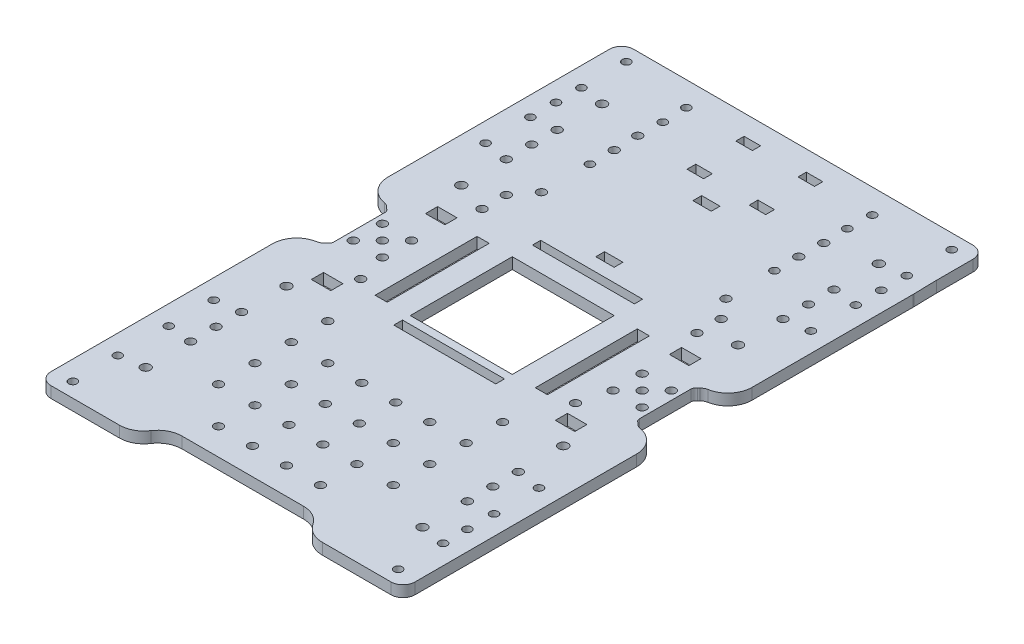
from build123d import *

# Parameters (mm, degrees)
SKETCH_2_W           = 130
SKETCH_2_H           = 200
SKETCH_2_R           = 1.8
EXTRUDE_1_DEPTH      = 4.6
FILLET_1_R           = 5
SKETCH_3_W           = 4
SKETCH_3_H           = 24
CUT_EXTRUDE_1_DEPTH  = 4.6
FILLET_2_R           = 2
FILLET_3_R           = 2
SKETCH_4_R           = 1.8
SKETCH_4_R_2         = 1.95
CUT_EXTRUDE_2_DEPTH  = 4.6
SKETCH_5_R           = 1.8
SKETCH_5_W           = 6.8
SKETCH_5_H           = 3.6
SKETCH_5_W_2         = 42
SKETCH_5_H_2         = 42
SKETCH_5_H_3         = 3.4
SKETCH_5_W_3         = 70
SKETCH_5_H_4         = 18
CUT_EXTRUDE_3_DEPTH  = 4.6
FILLET_4_R           = 10
FILLET_5_R           = 10
SKETCH_6_R           = 1.8
CUT_EXTRUDE_4_DEPTH  = 4.6
SKETCH_7_R           = 1.8
CUT_EXTRUDE_5_DEPTH  = 4.6
SKETCH_8_W           = 7.56096601
SKETCH_8_H           = 3.597038402
SKETCH_8_H_2         = 3.621629188
SKETCH_8_W_2         = 3.6
SKETCH_8_H_3         = 6.8
CUT_EXTRUDE_6_DEPTH  = 4.6
SKETCH_10_R          = 1.8
CUT_EXTRUDE_8_DEPTH  = 4.6
SKETCH_9_W           = 8
SKETCH_9_H           = 5
SKETCH_9_W_2         = 5
SKETCH_9_H_2         = 42
CUT_EXTRUDE_9_DEPTH  = 4.6
EXTRUDE_START        = 2
SKETCH_12_W          = 18.75
SKETCH_12_H          = 71.5
SKETCH_12_R          = 1.95
SKETCH_12_R_2        = 1.8
SKETCH_12_R_3        = 1.814304703
SKETCH_12_W_2        = 4
SKETCH_12_H_2        = 2
SKETCH_12_W_3        = 44.25
SKETCH_12_H_3        = 9.499668345
SKETCH_12_H_4        = 71.502072164
SKETCH_12_H_5        = 4.00066331
SKETCH_12_H_6        = 10.999668345
SKETCH_12_H_7        = 10.799999999
SKETCH_12_W_4        = 15.750000002
SKETCH_12_H_8        = 4
SKETCH_12_W_5        = 24.499999998
SKETCH_12_W_6        = 24.5
SKETCH_12_W_7        = 15.75
SKETCH_12_H_9        = 11
SKETCH_12_H_10       = 10.8
SKETCH_12_H_11       = 0.5
SKETCH_12_W_8        = 15.750000003
SKETCH_12_W_9        = 3.999999999
SKETCH_12_W_10       = 14.75
SKETCH_12_H_12       = 76.497927836
SKETCH_12_H_13       = 76.5
SKETCH_12_H_14       = 11.97
SKETCH_12_H_15       = 9.167588033
SKETCH_12_H_16       = 0.69
SKETCH_12_H_17       = 1.832411967
SKETCH_12_H_18       = 1.142411967
SKETCH_12_H_19       = 1.059701493
SKETCH_12_H_20       = 8.290597014
SKETCH_12_H_21       = 1.559701493
EXTRUDE_2_DEPTH      = 2
SKETCH_13_W          = 30
SKETCH_13_H          = 4
EXTRUDE_3_DEPTH      = 2
FILLET_6_R           = 5
SKETCH_14_W          = 42
SKETCH_14_H          = 3.4
EXTRUDE_4_DEPTH      = 4.6
SKETCH_15_W          = 42
SKETCH_15_H          = 3.6
CUT_EXTRUDE_10_DEPTH = 10
SKETCH_16_W          = 204.995685258
SKETCH_16_H          = 218.219063178
CUT_EXTRUDE_11_DEPTH = 2
SKETCH_17_W          = 15
SKETCH_17_H          = 86
EXTRUDE_5_DEPTH      = 4.6
FILLET_7_R           = 3.5
FILLET_8_R           = 10
SKETCH_18_R          = 1.7
SKETCH_18_R_2        = 1.8
CUT_EXTRUDE_12_DEPTH = 10
EXTRUDE_6_DEPTH      = 4.6
SKETCH_21_R          = 1.7
SKETCH_21_W          = 6.8
SKETCH_21_H          = 3.4
CUT_EXTRUDE_13_DEPTH = 10
SKETCH_23_W          = 5.699842395
SKETCH_23_H          = 8.457830651
SKETCH_23_W_2        = 8.457830652
SKETCH_23_H_2        = 10.84808714
SKETCH_23_W_3        = 8.83667556
SKETCH_23_H_3        = 72.0482929
SKETCH_23_W_4        = 8.515983726
SKETCH_23_H_4        = 70.769164604
SKETCH_23_H_5        = 67.65499986
EXTRUDE_7_DEPTH      = 4.6
SKETCH_22_R          = 1.7
SKETCH_22_R_2        = 1.8
CUT_EXTRUDE_14_DEPTH = 10
SKETCH_24_R          = 1.7
CUT_EXTRUDE_15_DEPTH = 10
FILLET_11_R          = 5
FILLET_12_R          = 10
FILLET_13_R          = 10


# Some blends are built 0.0001 mm under size
with BuildPart() as part:
    # 草图2 → 凸台-拉伸1 (new body)
    with BuildSketch(Plane(origin=(0, 0, 0), x_dir=(1, 0, 0), z_dir=(0, 1, 0))):
        Rectangle(SKETCH_2_W, SKETCH_2_H)
        with Locations(Location((-59.5, 6, 0), (0, 0, 270))):
            Circle(SKETCH_2_R, mode=Mode.SUBTRACT)
        with Locations(Location((-47.5, 6, 0), (0, 0, 270))):
            Circle(SKETCH_2_R, mode=Mode.SUBTRACT)
        with Locations(Location((-59.5, -6, 0), (0, 0, 270))):
            Circle(SKETCH_2_R, mode=Mode.SUBTRACT)
        with Locations(Location((-47.5, -6, 0), (0, 0, 270))):
            Circle(SKETCH_2_R, mode=Mode.SUBTRACT)
        with Locations(Location((-53.5, 0, 0), (0, 0, 270))):
            Circle(SKETCH_2_R, mode=Mode.SUBTRACT)
        with Locations(Location((53.5, 0, 0), (0, 0, 270))):
            Circle(SKETCH_2_R, mode=Mode.SUBTRACT)
        with Locations(Location((59.5, 6, 0), (0, 0, 270))):
            Circle(SKETCH_2_R, mode=Mode.SUBTRACT)
        with Locations(Location((59.5, -6, 0), (0, 0, 270))):
            Circle(SKETCH_2_R, mode=Mode.SUBTRACT)
        with Locations(Location((47.5, -6, 0), (0, 0, 270))):
            Circle(SKETCH_2_R, mode=Mode.SUBTRACT)
        with Locations(Location((47.5, 6, 0), (0, 0, 270))):
            Circle(SKETCH_2_R, mode=Mode.SUBTRACT)
    extrude(amount=EXTRUDE_1_DEPTH)

    # 圆角1
    fillet_1_edges = [part.edges().sort_by_distance(p)[0] for p in [
        (65, 2.3, 100),
        (-65, 2.3, 100),
        (-65, 2.3, -100),
        (65, 2.3, -100),
    ]]
    fillet(fillet_1_edges, radius=FILLET_1_R)

    # 草图3 → 切除-拉伸1 (cut)
    with BuildSketch(Plane(origin=(0, 4.6, 0), x_dir=(1, 0, 0), z_dir=(0, 1, 0))):
        with Locations((-65, 0)):
            Rectangle(SKETCH_3_W, SKETCH_3_H)
        with Locations((65, 0)):
            Rectangle(SKETCH_3_W, SKETCH_3_H)
    extrude(amount=-CUT_EXTRUDE_1_DEPTH, mode=Mode.SUBTRACT)

    # 圆角2
    fillet_2_edges = [part.edges().sort_by_distance(p)[0] for p in [
        (65, 2.3, 12),
        (65, 2.3, -12),
        (-65, 2.3, 12),
        (-65, 2.3, -12),
    ]]
    fillet(fillet_2_edges, radius=FILLET_2_R - 0.0001)  # a hair under: the kernel refuses the full size

    # 圆角3
    fillet_3_edges = [part.edges().sort_by_distance(p)[0] for p in [
        (-63, 2.3, 12),
        (-63, 2.3, -12),
        (63, 2.3, -12),
        (63, 2.3, 12),
    ]]
    fillet(fillet_3_edges, radius=FILLET_3_R)

    # 草图4 → 切除-拉伸2 (cut)
    with BuildSketch(Plane(origin=(0, 0, 0), x_dir=(1, 0, 0), z_dir=(0, 1, 0))):
        with Locations(Location((57, 65, 0), (0, 0, 270))):
            Circle(SKETCH_4_R)
        with Locations(Location((57, 75.5, 0), (0, 0, 270))):
            Circle(SKETCH_4_R)
        with Locations(Location((57, 54.5, 0), (0, 0, 270))):
            Circle(SKETCH_4_R)
        with Locations(Location((57, 94, 0), (0, 0, 270))):
            Circle(SKETCH_4_R_2)
        with Locations(Location((57, 36, 0), (0, 0, 270))):
            Circle(SKETCH_4_R_2)
        with Locations(Location((-57, 94, 0), (0, 0, 270))):
            Circle(SKETCH_4_R_2)
        with Locations(Location((-57, 75.5, 0), (0, 0, 270))):
            Circle(SKETCH_4_R)
        with Locations(Location((-57, 65, 0), (0, 0, 270))):
            Circle(SKETCH_4_R)
        with Locations(Location((-57, 54.5, 0), (0, 0, 270))):
            Circle(SKETCH_4_R)
        with Locations(Location((-57, 36, 0), (0, 0, 270))):
            Circle(SKETCH_4_R_2)
        with Locations(Location((-57, -36, 0), (0, 0, 270))):
            Circle(SKETCH_4_R_2)
        with Locations(Location((-57, -65, 0), (0, 0, 270))):
            Circle(SKETCH_4_R)
        with Locations(Location((-57, -54.5, 0), (0, 0, 270))):
            Circle(SKETCH_4_R)
        with Locations(Location((-57, -75.5, 0), (0, 0, 270))):
            Circle(SKETCH_4_R)
        with Locations(Location((-57, -94, 0), (0, 0, 270))):
            Circle(SKETCH_4_R_2)
        with Locations(Location((57, -65, 0), (0, 0, 270))):
            Circle(SKETCH_4_R)
        with Locations(Location((57, -75.5, 0), (0, 0, 270))):
            Circle(SKETCH_4_R)
        with Locations(Location((57, -54.5, 0), (0, 0, 270))):
            Circle(SKETCH_4_R)
        with Locations(Location((57, -36, 0), (0, 0, 270))):
            Circle(SKETCH_4_R_2)
        with Locations(Location((57, -94, 0), (0, 0, 270))):
            Circle(SKETCH_4_R_2)
    extrude(amount=CUT_EXTRUDE_2_DEPTH, mode=Mode.SUBTRACT)

    # 草图5 → 切除-拉伸3 (cut)
    with BuildSketch(Plane(origin=(0, 4.6, 0), x_dir=(1, 0, 0), z_dir=(0, 1, 0))):
        with Locations(Location((38.3, 90, 0), (0, 0, 270))):
            Circle(SKETCH_5_R)
        with Locations(Location((-38.3, 90, 0), (0, 0, 270))):
            Circle(SKETCH_5_R)
        with Locations((-12.8, 90)):
            Rectangle(SKETCH_5_W, SKETCH_5_H)
        with Locations((12.8, 90)):
            Rectangle(SKETCH_5_W, SKETCH_5_H)
        Rectangle(SKETCH_5_W_2, SKETCH_5_H_2)
        with Locations((0, 31)):
            Rectangle(SKETCH_5_W_2, SKETCH_5_H_3)
        with Locations((0, -31)):
            Rectangle(SKETCH_5_W_2, SKETCH_5_H_3)
        with Locations((0, -100)):
            Rectangle(SKETCH_5_W_3, SKETCH_5_H_4)
    extrude(amount=-CUT_EXTRUDE_3_DEPTH, mode=Mode.SUBTRACT)

    # 圆角4
    # the kernel refuses this fillet: 10 mm, written as the material it takes off along each edge
    with BuildSketch(Plane(origin=(-35, -24.874685928, 100), x_dir=(-1, 0, 0), z_dir=(0, 1, 0))) as fillet_4_piece_1:
        with BuildLine():
            CenterArc((9.949874371, -10), FILLET_4_R, 90, 84.260829523)
            Line((0, -9), (-0.198997487, -8.98))
            ThreePointArc((-0.198997487, -8.98), (-0.2, -4.5), (-0.2, 0))
            Line((-0.2, 0), (0, 0.2))
            Line((0, 0.2), (9.949874371, 0.2))
            Line((9.949874371, 0.2), (9.949874371, 0))
        make_face()
    extrude(amount=54.349371855, mode=Mode.SUBTRACT)
    with BuildSketch(Plane(origin=(35, 29.474685928, 100), x_dir=(0, 0, -1), z_dir=(0, -1, 0))) as fillet_4_piece_2:
        with BuildLine():
            CenterArc((10, 9.949874371), FILLET_4_R, 180, 84.260829523)
            Line((0, 9.949874371), (-0.2, 9.949874371))
            Line((-0.2, 9.949874371), (-0.2, 0))
            Line((-0.2, 0), (0, -0.2))
            ThreePointArc((0, -0.2), (4.5, -0.2), (8.98, -0.198997487))
            Line((8.98, -0.198997487), (9, 0))
        make_face()
    extrude(amount=54.349371855, mode=Mode.SUBTRACT)

    # 圆角5
    fillet_5_edges = [part.edges().sort_by_distance(p)[0] for p in [
        (35, 2.3, 91),
        (-35, 2.3, 91),
    ]]
    fillet(fillet_5_edges, radius=FILLET_5_R)

    # 草图6 → 切除-拉伸4 (cut)
    with BuildSketch(Plane(origin=(0, 4.6, 0), x_dir=(1, 0, 0), z_dir=(0, 1, 0))):
        with Locations(Location((-7, -85, 0), (0, 0, 270))):
            Circle(SKETCH_6_R)
        with Locations(Location((-21, -85, 0), (0, 0, 270))):
            Circle(SKETCH_6_R)
        with Locations(Location((7, -85, 0), (0, 0, 270))):
            Circle(SKETCH_6_R)
        with Locations(Location((21, -85, 0), (0, 0, 270))):
            Circle(SKETCH_6_R)
        with Locations(Location((21, -70, 0), (0, 0, 270))):
            Circle(SKETCH_6_R)
        with Locations(Location((7, -70, 0), (0, 0, 270))):
            Circle(SKETCH_6_R)
        with Locations(Location((-7, -70, 0), (0, 0, 270))):
            Circle(SKETCH_6_R)
        with Locations(Location((-21, -70, 0), (0, 0, 270))):
            Circle(SKETCH_6_R)
        with Locations(Location((-21, -55, 0), (0, 0, 270))):
            Circle(SKETCH_6_R)
        with Locations(Location((-7, -55, 0), (0, 0, 270))):
            Circle(SKETCH_6_R)
        with Locations(Location((7, -55, 0), (0, 0, 270))):
            Circle(SKETCH_6_R)
        with Locations(Location((21, -55, 0), (0, 0, 270))):
            Circle(SKETCH_6_R)
        with Locations(Location((36, -70, 0), (0, 0, 270))):
            Circle(SKETCH_6_R)
        with Locations(Location((36, -55, 0), (0, 0, 270))):
            Circle(SKETCH_6_R)
        with Locations(Location((36, -40, 0), (0, 0, 270))):
            Circle(SKETCH_6_R)
        with Locations(Location((-36, -40, 0), (0, 0, 270))):
            Circle(SKETCH_6_R)
        with Locations(Location((-36, -55, 0), (0, 0, 270))):
            Circle(SKETCH_6_R)
        with Locations(Location((-36, -70, 0), (0, 0, 270))):
            Circle(SKETCH_6_R)
    extrude(amount=-CUT_EXTRUDE_4_DEPTH, mode=Mode.SUBTRACT)

    # 草图7 → 切除-拉伸5 (cut)
    with BuildSketch(Plane(origin=(0, 4.6, 0), x_dir=(1, 0, 0), z_dir=(0, 1, 0))):
        with Locations(Location((-38, 80, 0), (0, 0, 270))):
            Circle(SKETCH_7_R)
        with Locations(Location((38, 80, 0), (0, 0, 270))):
            Circle(SKETCH_7_R)
        with Locations(Location((38, 50, 0), (0, 0, 270))):
            Circle(SKETCH_7_R)
        with Locations(Location((-38, 50, 0), (0, 0, 270))):
            Circle(SKETCH_7_R)
    extrude(amount=-CUT_EXTRUDE_5_DEPTH, mode=Mode.SUBTRACT)

    # 草图8 → 切除-拉伸6 (cut)
    with BuildSketch(Plane(origin=(0, 4.6, 0), x_dir=(1, 0, 0), z_dir=(0, 1, 0))):
        with Locations((0, 80)):
            Rectangle(SKETCH_8_W, SKETCH_8_H)
        with Locations((0, 40)):
            Rectangle(SKETCH_8_W, SKETCH_8_H_2)
        with Locations((35, 65)):
            Rectangle(SKETCH_8_W_2, SKETCH_8_H_3)
        with Locations((-35, 65)):
            Rectangle(SKETCH_8_W_2, SKETCH_8_H_3)
    extrude(amount=-CUT_EXTRUDE_6_DEPTH, mode=Mode.SUBTRACT)

    # 草图10 → 切除-拉伸8 (cut)
    with BuildSketch(Plane(origin=(0, 4.6, 0), x_dir=(1, 0, 0), z_dir=(0, 1, 0))):
        with Locations(Location((44.25, 41.8, 0), (0, 0, 270))):
            Circle(SKETCH_10_R)
        with Locations(Location((-44.25, 41.810125838, 0), (0, 0, 270))):
            Circle(SKETCH_10_R)
        with Locations(Location((-44.25, -18.189874162, 0), (0, 0, 270))):
            Circle(SKETCH_10_R)
        with Locations(Location((44.25, -18.2, 0), (0, 0, 270))):
            Circle(SKETCH_10_R)
        with Locations(Location((-44.25, 31.810125838, 0), (0, 0, 270))):
            Circle(SKETCH_10_R)
        with Locations(Location((44.25, 31.810125838, 0), (0, 0, 270))):
            Circle(SKETCH_10_R)
    extrude(amount=-CUT_EXTRUDE_8_DEPTH, mode=Mode.SUBTRACT)

    # 草图9 → 切除-拉伸9 (cut)
    with BuildSketch(Plane(origin=(0, 4.6, 0), x_dir=(1, 0, 0), z_dir=(0, 1, 0))):
        with Locations((-50.25, 21)):
            Rectangle(SKETCH_9_W, SKETCH_9_H)
        with Locations((50.25, 21)):
            Rectangle(SKETCH_9_W, SKETCH_9_H)
        with Locations((-50.25, -26)):
            Rectangle(SKETCH_9_W, SKETCH_9_H)
        with Locations((50.25, -26)):
            Rectangle(SKETCH_9_W, SKETCH_9_H)
        with Locations((33, 0)):
            Rectangle(SKETCH_9_W_2, SKETCH_9_H_2)
        with Locations((-33, 0)):
            Rectangle(SKETCH_9_W_2, SKETCH_9_H_2)
    extrude(amount=-CUT_EXTRUDE_9_DEPTH, mode=Mode.SUBTRACT)

    # 草图12 → 凸台-拉伸2 (add)
    # profile 1 of 46: a face of its own
    with BuildSketch(Plane.XZ.offset(EXTRUDE_START)):
        with Locations((-55.625, 64.25)):
            Rectangle(SKETCH_12_W, SKETCH_12_H)
        with Locations(Location((-57, 36, 0), (0, 0, 270))):
            Circle(SKETCH_12_R, mode=Mode.SUBTRACT)
        with Locations(Location((-57, 54.5, 0), (0, 0, 270))):
            Circle(SKETCH_12_R_2, mode=Mode.SUBTRACT)
        with Locations(Location((-57, 65, 0), (0, 0, 270))):
            Circle(SKETCH_12_R_3, mode=Mode.SUBTRACT)
        with Locations(Location((-57, 75.5, 0), (0, 0, 270))):
            Circle(SKETCH_12_R_2, mode=Mode.SUBTRACT)
        with Locations(Location((-57, 94, 0), (0, 0, 270))):
            Circle(SKETCH_12_R, mode=Mode.SUBTRACT)
    # profile 2 of 46: a face of its own
    with BuildSketch(Plane.XZ.offset(EXTRUDE_START)):
        with Locations((0, 90)):
            Rectangle(SKETCH_12_W_2, SKETCH_12_H_2)
    # profile 3 of 46: a face of its own
    with BuildSketch(Plane.XZ.offset(EXTRUDE_START)):
        with Locations((24.125, 90)):
            Rectangle(SKETCH_12_W_3, SKETCH_12_H_2)
    # profile 4 of 46: a face of its own
    with BuildSketch(Plane.XZ.offset(EXTRUDE_START)):
        with Locations((-24.125, 90)):
            Rectangle(SKETCH_12_W_3, SKETCH_12_H_2)
    # profile 5 of 46: a face of its own
    with BuildSketch(Plane.XZ.offset(EXTRUDE_START)):
        with Locations((0, 84.250165828)):
            Rectangle(SKETCH_12_W_2, SKETCH_12_H_3)
    # profile 6 of 46: a face of its own
    with BuildSketch(Plane.XZ.offset(EXTRUDE_START)):
        with Locations((55.625, 64.251036082)):
            Rectangle(SKETCH_12_W, SKETCH_12_H_4)
        with Locations(Location((57, 36, 0), (0, 0, 270))):
            Circle(SKETCH_12_R, mode=Mode.SUBTRACT)
        with Locations(Location((57, 54.5, 0), (0, 0, 270))):
            Circle(SKETCH_12_R_2, mode=Mode.SUBTRACT)
        with Locations(Location((57, 65, 0), (0, 0, 270))):
            Circle(SKETCH_12_R_2, mode=Mode.SUBTRACT)
        with Locations(Location((57, 75.5, 0), (0, 0, 270))):
            Circle(SKETCH_12_R_2, mode=Mode.SUBTRACT)
        with Locations(Location((57, 94, 0), (0, 0, 270))):
            Circle(SKETCH_12_R, mode=Mode.SUBTRACT)
    # profile 7 of 46: a face of its own
    with BuildSketch(Plane.XZ.offset(EXTRUDE_START)):
        with Locations((24.125, 77.5)):
            Rectangle(SKETCH_12_W_3, SKETCH_12_H_5)
    # profile 8 of 46: a face of its own
    with BuildSketch(Plane.XZ.offset(EXTRUDE_START)):
        with Locations((0, 77.5)):
            Rectangle(SKETCH_12_W_2, SKETCH_12_H_5)
    # profile 9 of 46: a face of its own
    with BuildSketch(Plane.XZ.offset(EXTRUDE_START)):
        with Locations((-24.125, 77.5)):
            Rectangle(SKETCH_12_W_3, SKETCH_12_H_5)
    # profile 10 of 46: a face of its own
    with BuildSketch(Plane.XZ.offset(EXTRUDE_START)):
        with Locations((0, 69.999834173)):
            Rectangle(SKETCH_12_W_2, SKETCH_12_H_6)
    # profile 11 of 46: a face of its own
    with BuildSketch(Plane.XZ.offset(EXTRUDE_START)):
        with Locations((28.5, 69.9)):
            Rectangle(SKETCH_12_W_2, SKETCH_12_H_7)
    # profile 12 of 46: a face of its own
    with BuildSketch(Plane.XZ.offset(EXTRUDE_START)):
        with Locations((-28.499999998, 69.9)):
            Rectangle(SKETCH_12_W_2, SKETCH_12_H_7)
    # profile 13 of 46: a face of its own
    with BuildSketch(Plane.XZ.offset(EXTRUDE_START)):
        with Locations((-38.374999999, 62.5)):
            Rectangle(SKETCH_12_W_4, SKETCH_12_H_8)
    # profile 14 of 46: a face of its own
    with BuildSketch(Plane.XZ.offset(EXTRUDE_START)):
        with Locations((-28.499999998, 62.5)):
            Rectangle(SKETCH_12_W_2, SKETCH_12_H_8)
    # profile 15 of 46: a face of its own
    with BuildSketch(Plane.XZ.offset(EXTRUDE_START)):
        with Locations((-14.249999999, 62.5)):
            Rectangle(SKETCH_12_W_5, SKETCH_12_H_8)
    # profile 16 of 46: a face of its own
    with BuildSketch(Plane.XZ.offset(EXTRUDE_START)):
        with Locations((0, 62.5)):
            Rectangle(SKETCH_12_W_2, SKETCH_12_H_8)
    # profile 17 of 46: a face of its own
    with BuildSketch(Plane.XZ.offset(EXTRUDE_START)):
        with Locations((14.25, 62.5)):
            Rectangle(SKETCH_12_W_6, SKETCH_12_H_8)
    # profile 18 of 46: a face of its own
    with BuildSketch(Plane.XZ.offset(EXTRUDE_START)):
        with Locations((28.5, 62.5)):
            Rectangle(SKETCH_12_W_2, SKETCH_12_H_8)
    # profile 19 of 46: a face of its own
    with BuildSketch(Plane.XZ.offset(EXTRUDE_START)):
        with Locations((38.375, 62.5)):
            Rectangle(SKETCH_12_W_7, SKETCH_12_H_8)
    # profile 20 of 46: a face of its own
    with BuildSketch(Plane.XZ.offset(EXTRUDE_START)):
        with Locations((28.5, 55)):
            Rectangle(SKETCH_12_W_2, SKETCH_12_H_9)
    # profile 21 of 46: a face of its own
    with BuildSketch(Plane.XZ.offset(EXTRUDE_START)):
        with Locations((38.375, 47.5)):
            Rectangle(SKETCH_12_W_7, SKETCH_12_H_8)
    # profile 22 of 46: a face of its own
    with BuildSketch(Plane.XZ.offset(EXTRUDE_START)):
        with Locations((28.5, 40.1)):
            Rectangle(SKETCH_12_W_2, SKETCH_12_H_10)
    # profile 23 of 46: a face of its own
    with BuildSketch(Plane.XZ.offset(EXTRUDE_START)):
        Polygon((-46.25, 34.7), (-46.25, 32.7), (46.25, 32.7), (46.25, 34.7), (30.5, 34.7), (26.5, 34.7), (-26.499999999, 34.7), (-30.499999997, 34.7), align=None)
    # profile 24 of 46: a face of its own
    with BuildSketch(Plane.XZ.offset(EXTRUDE_START)):
        with Locations((28.5, 47.5)):
            Rectangle(SKETCH_12_W_2, SKETCH_12_H_8)
    # profile 25 of 46: a face of its own
    with BuildSketch(Plane.XZ.offset(EXTRUDE_START)):
        Polygon((-26.499999998, 49.5), (-26.499999998, 45.5), (26.5, 45.5), (26.5, 49.5), (2, 49.5), (2, 49), (-2, 49), (-2, 49.5), align=None)
    # profile 26 of 46: a face of its own
    with BuildSketch(Plane.XZ.offset(EXTRUDE_START)):
        with Locations((0, 55)):
            Rectangle(SKETCH_12_W_2, SKETCH_12_H_9)
    # profile 27 of 46: a face of its own
    with BuildSketch(Plane.XZ.offset(EXTRUDE_START)):
        with Locations((0, 49.25)):
            Rectangle(SKETCH_12_W_2, SKETCH_12_H_11)
    # profile 28 of 46: a face of its own
    with BuildSketch(Plane.XZ.offset(EXTRUDE_START)):
        Polygon((-30.499999998, 60.5), (-30.499999997, 49.5), (-26.499999998, 49.5), (-26.499999998, 60.5), align=None)
    # profile 29 of 46: a face of its own
    with BuildSketch(Plane.XZ.offset(EXTRUDE_START)):
        with Locations((-38.374999999, 47.5)):
            Rectangle(SKETCH_12_W_8, SKETCH_12_H_8)
    # profile 30 of 46: a face of its own
    with BuildSketch(Plane.XZ.offset(EXTRUDE_START)):
        with Locations((-28.499999998, 47.5)):
            Rectangle(SKETCH_12_W_9, SKETCH_12_H_8)
    # profile 31 of 46: a face of its own
    with BuildSketch(Plane.XZ.offset(EXTRUDE_START)):
        Polygon((-30.499999997, 45.5), (-30.499999997, 34.699999999), (-26.499999999, 34.7), (-26.499999998, 45.5), align=None)
    # profile 32 of 46: a face of its own
    with BuildSketch(Plane.XZ.offset(EXTRUDE_START)):
        with Locations((57.625, -61.748963918)):
            Rectangle(SKETCH_12_W_10, SKETCH_12_H_12)
        with Locations(Location((57, -94, 0), (0, 0, 270))):
            Circle(SKETCH_12_R, mode=Mode.SUBTRACT)
        with Locations(Location((57, -75.5, 0), (0, 0, 270))):
            Circle(SKETCH_12_R_2, mode=Mode.SUBTRACT)
        with Locations(Location((57, -65, 0), (0, 0, 270))):
            Circle(SKETCH_12_R_2, mode=Mode.SUBTRACT)
        with Locations(Location((57, -54.5, 0), (0, 0, 270))):
            Circle(SKETCH_12_R_2, mode=Mode.SUBTRACT)
        with Locations(Location((57, -36, 0), (0, 0, 270))):
            Circle(SKETCH_12_R, mode=Mode.SUBTRACT)
    # profile 33 of 46: a face of its own
    with BuildSketch(Plane.XZ.offset(EXTRUDE_START)):
        with Locations((-57.625, -61.75)):
            Rectangle(SKETCH_12_W_10, SKETCH_12_H_13)
        with Locations(Location((-57, -36, 0), (0, 0, 270))):
            Circle(SKETCH_12_R, mode=Mode.SUBTRACT)
        with Locations(Location((-57, -54.5, 0), (0, 0, 270))):
            Circle(SKETCH_12_R_2, mode=Mode.SUBTRACT)
        with Locations(Location((-57, -65, 0), (0, 0, 270))):
            Circle(SKETCH_12_R_2, mode=Mode.SUBTRACT)
        with Locations(Location((-57, -75.5, 0), (0, 0, 270))):
            Circle(SKETCH_12_R_2, mode=Mode.SUBTRACT)
        with Locations(Location((-57, -94, 0), (0, 0, 270))):
            Circle(SKETCH_12_R, mode=Mode.SUBTRACT)
    # profile 34 of 46: a face of its own
    with BuildSketch(Plane.XZ.offset(EXTRUDE_START)):
        Polygon((50.25, -54.875), (-50.25, -54.875), (-50.25, -58.875), (-2, -58.875), (2, -58.875), (50.25, -58.875), align=None)
    # profile 35 of 46: a face of its own
    with BuildSketch(Plane.XZ.offset(EXTRUDE_START)):
        with Locations((0, -64.86)):
            Rectangle(SKETCH_12_W_2, SKETCH_12_H_14)
    # profile 36 of 46: a face of its own
    with BuildSketch(Plane.XZ.offset(EXTRUDE_START)):
        Polygon((-2, -70.845), (-50.25, -70.845), (-50.25, -74.845), (-21.990241502, -74.845), (-21.990241502, -74.155), (-17.990241502, -74.155), (-17.990241502, -74.845), (17.990241502, -74.845), (21.990241502, -74.845), (50.25, -74.845), (50.25, -70.845), (2, -70.845), align=None)
    # profile 37 of 46: a face of its own
    with BuildSketch(Plane.XZ.offset(EXTRUDE_START)):
        with Locations((19.990241502, -79.428794017)):
            Rectangle(SKETCH_12_W_2, SKETCH_12_H_15)
    # profile 38 of 46: a face of its own
    with BuildSketch(Plane.XZ.offset(EXTRUDE_START)):
        with Locations((-19.990241502, -79.428794017)):
            Rectangle(SKETCH_12_W_2, SKETCH_12_H_15)
    # profile 39 of 46: a face of its own
    with BuildSketch(Plane.XZ.offset(EXTRUDE_START)):
        with Locations((-19.990241502, -74.5)):
            Rectangle(SKETCH_12_W_2, SKETCH_12_H_16)
    # profile 40 of 46: a face of its own
    with BuildSketch(Plane.XZ.offset(EXTRUDE_START)):
        Polygon((-50.25, -84.012588033), (-50.25, -86.012588033), (-2, -86.012588033), (-2, -84.95288654), (2, -84.95288654), (2, -86.012588033), (50.25, -86.012588033), (50.25, -84.012588033), (21.990241502, -84.012588033), (21.990241502, -85.155), (17.990241502, -85.155), (17.990241502, -84.012588033), (-17.990241502, -84.012588033), (-17.990241502, -85.845), (-21.990241502, -85.845), (-21.990241502, -84.012588033), align=None)
    # profile 41 of 46: a face of its own
    with BuildSketch(Plane.XZ.offset(EXTRUDE_START)):
        with Locations((-19.990241502, -84.928794017)):
            Rectangle(SKETCH_12_W_2, SKETCH_12_H_17)
    # profile 42 of 46: a face of its own
    with BuildSketch(Plane.XZ.offset(EXTRUDE_START)):
        with Locations((19.990241502, -84.583794017)):
            Rectangle(SKETCH_12_W_2, SKETCH_12_H_18)
    # profile 43 of 46: a face of its own
    with BuildSketch(Plane.XZ.offset(EXTRUDE_START)):
        with Locations((0, -85.482737286)):
            Rectangle(SKETCH_12_W_2, SKETCH_12_H_19)
    # profile 44 of 46: a face of its own
    with BuildSketch(Plane.XZ.offset(EXTRUDE_START)):
        with Locations((0, -90.15788654)):
            Rectangle(SKETCH_12_W_2, SKETCH_12_H_20)
    # profile 45 of 46: a face of its own
    with BuildSketch(Plane.XZ.offset(EXTRUDE_START)):
        Polygon((-50.25, -94.303185047), (-50.25, -97.303185047), (50.25, -97.303185047), (50.25, -94.303185047), (2, -94.303185047), (2, -95.86288654), (-2, -95.86288654), (-2, -94.303185047), align=None)
    # profile 46 of 46: a face of its own
    with BuildSketch(Plane.XZ.offset(EXTRUDE_START)):
        with Locations((0, -95.083035794)):
            Rectangle(SKETCH_12_W_2, SKETCH_12_H_21)
    extrude(amount=-EXTRUDE_2_DEPTH)

    # 草图13 → 凸台-拉伸3 (add)
    with BuildSketch(Plane.XZ):
        with Locations((0, -43.810814594)):
            Rectangle(SKETCH_13_W, SKETCH_13_H)
    extrude(amount=EXTRUDE_3_DEPTH)

    # 圆角6
    # the kernel refuses this fillet: 5 mm, written as the material it takes off along each edge
    with BuildSketch(Plane(origin=(-65, -2, -100), x_dir=(0, 0, 1), z_dir=(0, 1, 0)), Plane(origin=(-65, -2, 100), x_dir=(1, 0, 0), z_dir=(0, 1, 0)), Plane(origin=(65, -2, 100.002072164), x_dir=(0, 0, -1), z_dir=(0, 1, 0))) as fillet_6_piece_1:
        with BuildLine():
            CenterArc((FILLET_6_R, FILLET_6_R), FILLET_6_R, 180, 90)
            Line((0, FILLET_6_R), (-FILLET_6_R * 0.02, FILLET_6_R))
            Line((-FILLET_6_R * 0.02, FILLET_6_R), (-FILLET_6_R * 0.02, -FILLET_6_R * 0.02))
            Line((-FILLET_6_R * 0.02, -FILLET_6_R * 0.02), (FILLET_6_R, -FILLET_6_R * 0.02))
            Line((FILLET_6_R, -FILLET_6_R * 0.02), (FILLET_6_R, 0))
        make_face()
    extrude(amount=2, mode=Mode.SUBTRACT)
    with BuildSketch(Plane(origin=(65, -2, -99.997927836), x_dir=(0, 0, 1), z_dir=(0, 1, 0))) as fillet_6_piece_2:
        with BuildLine():
            CenterArc((FILLET_6_R, -FILLET_6_R), FILLET_6_R, 90, 90)
            Line((0, -FILLET_6_R), (-FILLET_6_R * 0.02, -FILLET_6_R))
            Line((-FILLET_6_R * 0.02, -FILLET_6_R), (-FILLET_6_R * 0.02, FILLET_6_R * 0.02))
            Line((-FILLET_6_R * 0.02, FILLET_6_R * 0.02), (FILLET_6_R, FILLET_6_R * 0.02))
            Line((FILLET_6_R, FILLET_6_R * 0.02), (FILLET_6_R, 0))
        make_face()
    extrude(amount=2, mode=Mode.SUBTRACT)

    # 草图14 → 凸台-拉伸4 (add)
    with BuildSketch(Plane(origin=(0, 4.6, 0), x_dir=(1, 0, 0), z_dir=(0, 1, 0))):
        with Locations((0, -31)):
            Rectangle(SKETCH_14_W, SKETCH_14_H)
    extrude(amount=-EXTRUDE_4_DEPTH)

    # 草图15 → 切除-拉伸10 (cut)
    with BuildSketch(Plane(origin=(0, 4.6, 0), x_dir=(1, 0, 0), z_dir=(0, 1, 0))):
        with Locations((0, -26)):
            Rectangle(SKETCH_15_W, SKETCH_15_H)
    extrude(amount=-CUT_EXTRUDE_10_DEPTH, mode=Mode.SUBTRACT)

    # 草图16 → 切除-拉伸11 (cut)
    with BuildSketch(Plane.XZ):
        Rectangle(SKETCH_16_W, SKETCH_16_H)
    extrude(amount=CUT_EXTRUDE_11_DEPTH, mode=Mode.SUBTRACT)

    # 草图17 → 凸台-拉伸5 (add)
    with BuildSketch(Plane(origin=(0, 0, 0), x_dir=(1, 0, 0), z_dir=(0, 1, 0))):
        with Locations((-67.5, -57)):
            Rectangle(SKETCH_17_W, SKETCH_17_H)
        with Locations((67.5, -57)):
            Rectangle(SKETCH_17_W, SKETCH_17_H)
        with Locations((-67.5, 57)):
            Rectangle(SKETCH_17_W, SKETCH_17_H)
        with Locations((67.5, 57)):
            Rectangle(SKETCH_17_W, SKETCH_17_H)
    extrude(amount=EXTRUDE_5_DEPTH)

    # 圆角7
    fillet_7_edges = [part.edges().sort_by_distance(p)[0] for p in [
        (65, 2.3, 14),
        (65, 2.3, -14),
        (-65, 2.3, 14),
        (-65, 2.3, -14),
    ]]
    fillet(fillet_7_edges, radius=FILLET_7_R)

    # 圆角8
    fillet_8_edges = [part.edges().sort_by_distance(p)[0] for p in [
        (75, 2.3, -100),
        (-75, 2.3, -100),
        (-75, 2.3, -14),
        (-75, 2.3, 14),
        (-75, 2.3, 100),
        (75, 2.3, 100),
        (75, 2.3, -14),
        (75, 2.3, 14),
    ]]
    fillet(fillet_8_edges, radius=FILLET_8_R)

    # 草图18 → 切除-拉伸12 (cut)
    with BuildSketch(Plane(origin=(0, 4.6, 0), x_dir=(1, 0, 0), z_dir=(0, 1, 0))):
        with Locations(Location((67, 75.5, 0), (0, 0, 270))):
            Circle(SKETCH_18_R)
        with Locations(Location((67, 65, 0), (0, 0, 270))):
            Circle(SKETCH_18_R)
        with Locations(Location((67, 54.5, 0), (0, 0, 270))):
            Circle(SKETCH_18_R)
        with Locations(Location((67, -54.5, 0), (0, 0, 270))):
            Circle(SKETCH_18_R)
        with Locations(Location((67, -65, 0), (0, 0, 270))):
            Circle(SKETCH_18_R)
        with Locations(Location((67, -75.5, 0), (0, 0, 270))):
            Circle(SKETCH_18_R)
        with Locations(Location((-67, -75.5, 0), (0, 0, 270))):
            Circle(SKETCH_18_R)
        with Locations(Location((-67, -65, 0), (0, 0, 270))):
            Circle(SKETCH_18_R)
        with Locations(Location((-67, -54.5, 0), (0, 0, 270))):
            Circle(SKETCH_18_R)
        with Locations(Location((-67, 54.5, 0), (0, 0, 270))):
            Circle(SKETCH_18_R)
        with Locations(Location((-67, 65, 0), (0, 0, 270))):
            Circle(SKETCH_18_R)
        with Locations(Location((-67, 75.5, 0), (0, 0, 270))):
            Circle(SKETCH_18_R)
        with Locations(Location((-67, 94, 0), (0, 0, 270))):
            Circle(SKETCH_18_R_2)
        with Locations(Location((67, -94, 0), (0, 0, 270))):
            Circle(SKETCH_18_R_2)
        with Locations(Location((67, -36, 0), (0, 0, 270))):
            Circle(SKETCH_18_R_2)
        with Locations(Location((-67, -36, 0), (0, 0, 270))):
            Circle(SKETCH_18_R_2)
        with Locations(Location((-67, -94, 0), (0, 0, 270))):
            Circle(SKETCH_18_R_2)
        with Locations(Location((-67, 36, 0), (0, 0, 270))):
            Circle(SKETCH_18_R_2)
        with Locations(Location((67, 36, 0), (0, 0, 270))):
            Circle(SKETCH_18_R_2)
        with Locations(Location((67, 94, 0), (0, 0, 270))):
            Circle(SKETCH_18_R_2)
    extrude(amount=-CUT_EXTRUDE_12_DEPTH, mode=Mode.SUBTRACT)

    # 草图20 → 凸台-拉伸6 (add)
    with BuildSketch(Plane(origin=(0, 4.6, 0), x_dir=(1, 0, 0), z_dir=(0, 1, 0))):
        Polygon((-75, 90), (-75, 100), (-75, 120), (74.784950422, 120), (74.784950422, 100), (75, 90), (69.197558317, 97.25929085), (60.829990815, 97.25929085), (-66.346094986, 97.25929085), align=None)
        Polygon((-75, -90), (-75, -100), (-75, -120), (-35, -120), (-35, -111), (35, -111), (35, -120), (75, -120), (75, -100), (75, -90), (69.197558317, -96.594063824), (44.920087631, -96.594063824), (31.601725969, -88.983571446), (-48.612863695, -88.983571446), (-52.265900036, -97.659532757), (-69.468598038, -96.594063824), align=None)
    extrude(amount=-EXTRUDE_6_DEPTH)

    # 草图21 → 切除-拉伸13 (cut)
    with BuildSketch(Plane(origin=(0, 4.6, 0), x_dir=(1, 0, 0), z_dir=(0, 1, 0))):
        with Locations(Location((-38.3, 110, 0), (0, 0, 270))):
            Circle(SKETCH_21_R)
        with Locations(Location((38.3, 110, 0), (0, 0, 270))):
            Circle(SKETCH_21_R)
        with Locations((-12.8, 110)):
            Rectangle(SKETCH_21_W, SKETCH_21_H)
        with Locations((12.8, 110)):
            Rectangle(SKETCH_21_W, SKETCH_21_H)
    extrude(amount=-CUT_EXTRUDE_13_DEPTH, mode=Mode.SUBTRACT)

    # 草图23 → 凸台-拉伸7 (add)
    with BuildSketch(Plane(origin=(0, 4.6, 0), x_dir=(1, 0, 0), z_dir=(0, 1, 0))):
        with Locations((-35.027520885, 65.087113114)):
            Rectangle(SKETCH_23_W, SKETCH_23_H)
        with Locations((34.657649048, 65.087113114)):
            Rectangle(SKETCH_23_W_2, SKETCH_23_H_2)
        with Locations((-67, 65)):
            Rectangle(SKETCH_23_W_3, SKETCH_23_H_3)
        with Locations((67, 65)):
            Rectangle(SKETCH_23_W_4, SKETCH_23_H_3)
        with Locations((67, -65)):
            Rectangle(SKETCH_23_W_4, SKETCH_23_H_4)
        with Locations((-67, -65)):
            Rectangle(SKETCH_23_W_3, SKETCH_23_H_5)
    extrude(amount=-EXTRUDE_7_DEPTH)

    # 草图22 → 切除-拉伸14 (cut)
    with BuildSketch(Plane(origin=(0, 4.6, 0), x_dir=(1, 0, 0), z_dir=(0, 1, 0))):
        with Locations(Location((-38, 70, 0), (0, 0, 270))):
            Circle(SKETCH_22_R)
        with Locations(Location((-38, 100, 0), (0, 0, 270))):
            Circle(SKETCH_22_R)
        with Locations(Location((38, 100, 0), (0, 0, 270))):
            Circle(SKETCH_22_R)
        with Locations(Location((38, 70, 0), (0, 0, 270))):
            Circle(SKETCH_22_R)
        with Locations(Location((36, -85, 0), (0, 0, 270))):
            Circle(SKETCH_22_R_2)
        with Locations(Location((-36, -85, 0), (0, 0, 270))):
            Circle(SKETCH_22_R_2)
        with Locations(Location((-21, -100, 0), (0, 0, 270))):
            Circle(SKETCH_22_R_2)
        with Locations(Location((-7, -100, 0), (0, 0, 270))):
            Circle(SKETCH_22_R_2)
        with Locations(Location((7, -100, 0), (0, 0, 270))):
            Circle(SKETCH_22_R_2)
        with Locations(Location((21, -100, 0), (0, 0, 270))):
            Circle(SKETCH_22_R_2)
    extrude(amount=-CUT_EXTRUDE_14_DEPTH, mode=Mode.SUBTRACT)

    # 草图24 → 切除-拉伸15 (cut)
    with BuildSketch(Plane(origin=(0, 4.6, 0), x_dir=(1, 0, 0), z_dir=(0, 1, 0))):
        with Locations(Location((67, -56, 0), (0, 0, 270))):
            Circle(SKETCH_24_R)
        with Locations(Location((67, -74.5, 0), (0, 0, 270))):
            Circle(SKETCH_24_R)
        with Locations(Location((67, -85.5, 0), (0, 0, 270))):
            Circle(SKETCH_24_R)
        with Locations(Location((67, -95.5, 0), (0, 0, 270))):
            Circle(SKETCH_24_R)
        with Locations(Location((67, -114, 0), (0, 0, 270))):
            Circle(SKETCH_24_R)
        with Locations(Location((-67, -114, 0), (0, 0, 270))):
            Circle(SKETCH_24_R)
        with Locations(Location((-67, -95.5, 0), (0, 0, 270))):
            Circle(SKETCH_24_R)
        with Locations(Location((-67, -74.5, 0), (0, 0, 270))):
            Circle(SKETCH_24_R)
        with Locations(Location((-67, -56, 0), (0, 0, 270))):
            Circle(SKETCH_24_R)
        with Locations(Location((-67, 56, 0), (0, 0, 270))):
            Circle(SKETCH_24_R)
        with Locations(Location((-67, 74.5, 0), (0, 0, 270))):
            Circle(SKETCH_24_R)
        with Locations(Location((-67, 85, 0), (0, 0, 270))):
            Circle(SKETCH_24_R)
        with Locations(Location((-67, 95.5, 0), (0, 0, 270))):
            Circle(SKETCH_24_R)
        with Locations(Location((-67, 114, 0), (0, 0, 270))):
            Circle(SKETCH_24_R)
        with Locations(Location((67, 114, 0), (0, 0, 270))):
            Circle(SKETCH_24_R)
        with Locations(Location((67, 95.5, 0), (0, 0, 270))):
            Circle(SKETCH_24_R)
        with Locations(Location((67, 85, 0), (0, 0, 270))):
            Circle(SKETCH_24_R)
        with Locations(Location((67, 74.5, 0), (0, 0, 270))):
            Circle(SKETCH_24_R)
        with Locations(Location((67, 56, 0), (0, 0, 270))):
            Circle(SKETCH_24_R)
    extrude(amount=-CUT_EXTRUDE_15_DEPTH, mode=Mode.SUBTRACT)

    # 圆角11
    fillet_11_edges = [part.edges().sort_by_distance(p)[0] for p in [
        (-75, 2.3, -120),
        (74.784950422, 2.3, -120),
        (75, 2.3, 120),
        (-75, 2.3, 120),
    ]]
    fillet(fillet_11_edges, radius=FILLET_11_R)

    # 圆角12
    # the kernel refuses this fillet: 10 mm, written as the material it adds along each edge
    with BuildSketch(Plane(origin=(-35, 4.6, 111), x_dir=(0, 0, 1), z_dir=(0, -1, 0))) as fillet_12_piece_1:
        with BuildLine():
            CenterArc((10, -9.949874371), FILLET_12_R, 95.739170477, 84.260829523)
            Line((0, -9.949874371), (-0.2, -9.949874371))
            Line((-0.2, -9.949874371), (-0.2, 0))
            Line((-0.2, 0), (0, 0.2))
            ThreePointArc((0, 0.2), (4.5, 0.2), (8.98, 0.198997487))
            Line((8.98, 0.198997487), (9, 0))
        make_face()
    extrude(amount=4.6)
    with BuildSketch(Plane(origin=(35, 4.6, 111), x_dir=(-1, 0, 0), z_dir=(0, -1, 0))) as fillet_12_piece_2:
        with BuildLine():
            CenterArc((9.949874371, -10), FILLET_12_R, 90, 84.260829523)
            Line((0, -9), (-0.198997487, -8.98))
            ThreePointArc((-0.198997487, -8.98), (-0.2, -4.5), (-0.2, 0))
            Line((-0.2, 0), (0, 0.2))
            Line((0, 0.2), (9.949874371, 0.2))
            Line((9.949874371, 0.2), (9.949874371, 0))
        make_face()
    extrude(amount=4.6)

    # 圆角13
    fillet_13_edges = [part.edges().sort_by_distance(p)[0] for p in [
        (35, 2.3, 120),
        (-35, 2.3, 120),
    ]]
    fillet(fillet_13_edges, radius=FILLET_13_R)


solid = part.part
